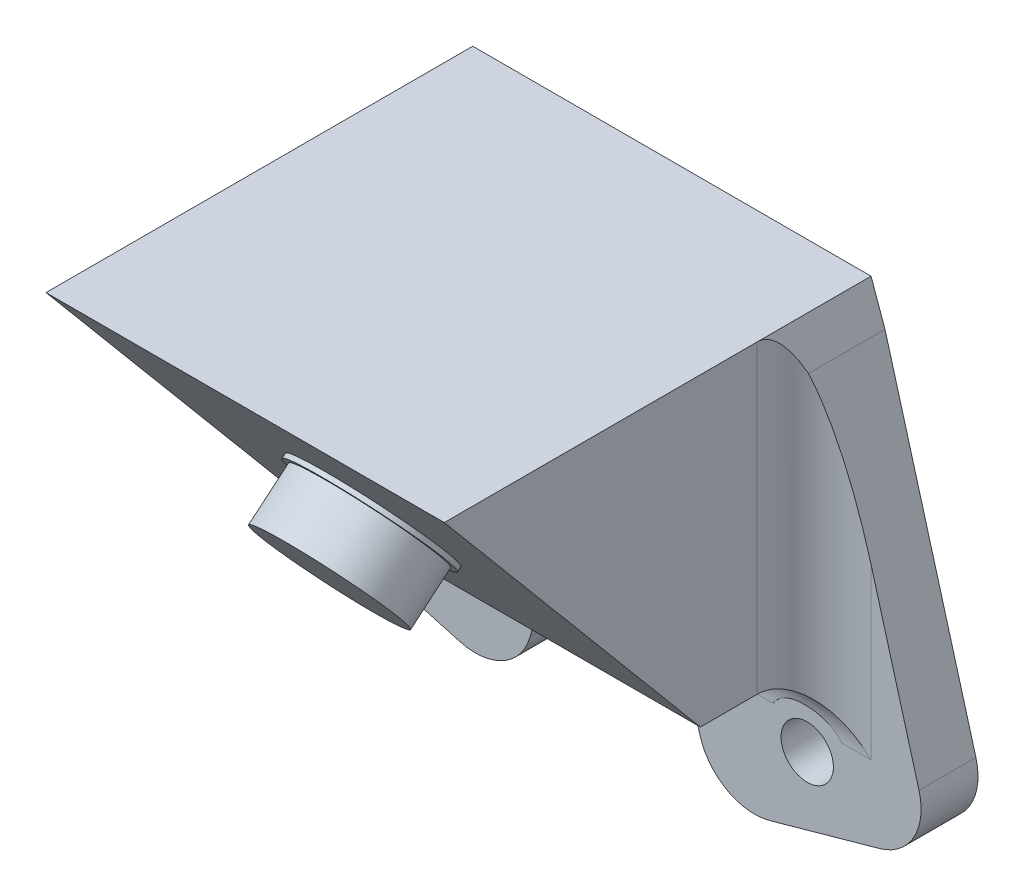
from build123d import *

# Parameters (mm, degrees)
AUFSATZ_LINEAR_AUSTRAGEN1_DEPTH    = 35
SKIZZE3_R                          = 6
AUFSATZ_LINEAR_AUSTRAGEN2_DEPTH    = 5
SKIZZE4_R                          = 6.5
AUFSATZ_LINEAR_AUSTRAGEN3_DEPTH    = 0.4
K_RPER_VERSCHIEBEN_KOPIEREN1_ANGLE = 90
SKIZZE9_R                          = 2.3
AUFSATZ_LINEAR_AUSTRAGEN4_DEPTH    = 5
VERRUNDUNG1_R                      = 5
SKIZZE11_R                         = 3.75
SCHNITT_LINEAR_AUSTRAGEN2_DEPTH    = 10
SKIZZE12_R                         = 1.425
SCHNITT_LINEAR_AUSTRAGEN3_DEPTH    = 9


with BuildPart() as part:
    # Skizze1 → Aufsatz-Linear austragen1 (new body)
    with BuildSketch(Plane(origin=(0, 0, 0), x_dir=(0, 0, -1), z_dir=(1, 0, 0))):
        Polygon((0, 0), (26.811555509, 0), (26.811555509, 37.497566339), (0, 15), align=None)
    extrude(amount=AUFSATZ_LINEAR_AUSTRAGEN1_DEPTH)

    # Skizze3 → Aufsatz-Linear austragen2 (add)
    with BuildSketch(Plane(origin=(0, 8.802361333, 7.386058148), x_dir=(1, 0, 0), z_dir=(0, 0.7660444431189768, 0.642787609686541))):
        with Locations(Location((17.5, 27.141814145, 0), (0, 0, 90))):
            Circle(SKIZZE3_R)
    extrude(amount=AUFSATZ_LINEAR_AUSTRAGEN2_DEPTH)

    # Skizze4 → Aufsatz-Linear austragen3 (add)
    with BuildSketch(Plane(origin=(0, 8.802361333, 7.386058148), x_dir=(1, 0, 0), z_dir=(0, 0.7660444431189767, 0.6427876096865409))):
        with Locations(Location((17.5, 27.141814145, 0), (0, 0, 90))):
            Circle(SKIZZE4_R)
    extrude(amount=AUFSATZ_LINEAR_AUSTRAGEN3_DEPTH)


with BuildPart() as part_1:
    # Körper-Verschieben/Kopieren1: moved
    add(part.part.rotate(Axis((0, 13.64378317, -13.405777755), (1, 0, 0)), K_RPER_VERSCHIEBEN_KOPIEREN1_ANGLE))

    # Skizze9 → Aufsatz-Linear austragen4 (add)
    # profile 1 of 2: a face of its own
    with BuildSketch(Plane(origin=(0, 0, -27.049560924), x_dir=(-1, 0, 0), z_dir=(0, 0, -1))):
        Polygon((-13.006801175, 0.238005415), (-8.700779715, -15.171672686), (10.561317912, -9.789145862), (1.223844944, 23.626259531), (0, 27.049560924), (0, 0.238005415), align=None)
        with Locations(Location((-0.609417277, -6.970434083, 0), (0, 0, 90))):
            Circle(SKIZZE9_R, mode=Mode.SUBTRACT)
    # profile 2 of 2: a face of its own
    with BuildSketch(Plane(origin=(0, 0, -27.049560924), x_dir=(-1, 0, 0), z_dir=(0, 0, -1))):
        Polygon((-45.561317912, -9.789145862), (-36.223844944, 23.626259531), (-35, 27.049560924), (-35, 0.238005415), (-21.993198825, 0.238005415), (-26.299220285, -15.171672686), align=None)
        with Locations(Location((-34.390582723, -6.970434083, 0), (0, 0, 270))):
            Circle(SKIZZE9_R, mode=Mode.SUBTRACT)
    extrude(amount=-AUFSATZ_LINEAR_AUSTRAGEN4_DEPTH)

    # Verrundung1
    # the kernel refuses this fillet: 5 mm, written as the material it adds along each edge
    with BuildSketch(Plane(origin=(35, 27.049560924, -22.049560924), x_dir=(1, 0, 0), z_dir=(0, -1, 0))) as verrundung1_piece_1_section:
        with BuildLine():
            CenterArc((VERRUNDUNG1_R, VERRUNDUNG1_R), VERRUNDUNG1_R, 180, 90)
            Line((0, VERRUNDUNG1_R), (-VERRUNDUNG1_R * 0.02, VERRUNDUNG1_R))
            Line((-VERRUNDUNG1_R * 0.02, VERRUNDUNG1_R), (-VERRUNDUNG1_R * 0.02, -VERRUNDUNG1_R * 0.02))
            Line((-VERRUNDUNG1_R * 0.02, -VERRUNDUNG1_R * 0.02), (VERRUNDUNG1_R, -VERRUNDUNG1_R * 0.02))
            Line((VERRUNDUNG1_R, -VERRUNDUNG1_R * 0.02), (VERRUNDUNG1_R, 0))
        make_face()
    verrundung1_piece_1 = extrude(amount=26.811555509, mode=Mode.PRIVATE)
    verrundung1_piece_1 = split(verrundung1_piece_1, bisect_by=Plane(origin=(39.17481741, 13.065806869, -20.82374956), z_dir=(-0.9631048813334838, -0.2691263412444353, -1.6244750072279728e-13)), keep=Keep.TOP, mode=Mode.PRIVATE)
    verrundung1_piece_1 = split(verrundung1_piece_1, bisect_by=Plane(origin=(39.826476164, 13.549090416, -20.82374956), z_dir=(-0.9416340631335743, -0.3366382199729496, -2.0319838344143382e-13)), keep=Keep.TOP, mode=Mode.PRIVATE)
    add(verrundung1_piece_1)
    with BuildSketch(Plane(origin=(35, 0.238005415, -22.049560924), x_dir=(0, 0, 1), z_dir=(-1, 0, 0))) as verrundung1_piece_2_section:
        with BuildLine():
            CenterArc((VERRUNDUNG1_R, -VERRUNDUNG1_R), VERRUNDUNG1_R, 90, 90)
            Line((0, -VERRUNDUNG1_R), (-VERRUNDUNG1_R * 0.02, -VERRUNDUNG1_R))
            Line((-VERRUNDUNG1_R * 0.02, -VERRUNDUNG1_R), (-VERRUNDUNG1_R * 0.02, VERRUNDUNG1_R * 0.02))
            Line((-VERRUNDUNG1_R * 0.02, VERRUNDUNG1_R * 0.02), (VERRUNDUNG1_R, VERRUNDUNG1_R * 0.02))
            Line((VERRUNDUNG1_R, VERRUNDUNG1_R * 0.02), (VERRUNDUNG1_R, 0))
        make_face()
    verrundung1_piece_2 = extrude(amount=25.506801175, mode=Mode.PRIVATE)
    verrundung1_piece_2 = split(verrundung1_piece_2, bisect_by=Plane(origin=(22.762065147, -2.513486336, -20.902354356), z_dir=(0.9631048813334842, 0.2691263412444339, 1.6244750072279647e-13)), keep=Keep.TOP, mode=Mode.PRIVATE)
    verrundung1_piece_2 = verrundung1_piece_2 - Plane(origin=(34.390582723, -6.970434083, -20.902354356), x_dir=(0, -1, 0), z_dir=(0, 0, -1)) * Cylinder(2.3, 72, mode=Mode.PRIVATE)
    add(verrundung1_piece_2)
    with BuildSketch(Plane(origin=(35, 0.238005415, -22.049560924), x_dir=(0, 0, 1), z_dir=(-1, 0, 0))) as verrundung1_piece_3_section:
        with BuildLine():
            CenterArc((VERRUNDUNG1_R, -VERRUNDUNG1_R), VERRUNDUNG1_R, 90, 90)
            Line((0, -VERRUNDUNG1_R), (-VERRUNDUNG1_R * 0.02, -VERRUNDUNG1_R))
            Line((-VERRUNDUNG1_R * 0.02, -VERRUNDUNG1_R), (-VERRUNDUNG1_R * 0.02, VERRUNDUNG1_R * 0.02))
            Line((-VERRUNDUNG1_R * 0.02, VERRUNDUNG1_R * 0.02), (VERRUNDUNG1_R, VERRUNDUNG1_R * 0.02))
            Line((VERRUNDUNG1_R, VERRUNDUNG1_R * 0.02), (VERRUNDUNG1_R, 0))
        make_face()
    verrundung1_piece_3 = extrude(amount=25.506801175, mode=Mode.PRIVATE)
    verrundung1_piece_3 = split(verrundung1_piece_3, bisect_by=Plane(origin=(12.602046932, -1.210462189, -20.857593889), z_dir=(-0.9631048813334842, 0.26912634124443413, 1.6244750072279654e-13)), keep=Keep.TOP, mode=Mode.PRIVATE)
    add(verrundung1_piece_3)
    with BuildSketch(Plane(origin=(0, 0.238005415, -22.049560924), x_dir=(0, 0, 1), z_dir=(1, 0, 0))) as verrundung1_piece_4_section:
        with BuildLine():
            CenterArc((VERRUNDUNG1_R, VERRUNDUNG1_R), VERRUNDUNG1_R, 180, 90)
            Line((0, VERRUNDUNG1_R), (-VERRUNDUNG1_R * 0.02, VERRUNDUNG1_R))
            Line((-VERRUNDUNG1_R * 0.02, VERRUNDUNG1_R), (-VERRUNDUNG1_R * 0.02, -VERRUNDUNG1_R * 0.02))
            Line((-VERRUNDUNG1_R * 0.02, -VERRUNDUNG1_R * 0.02), (VERRUNDUNG1_R, -VERRUNDUNG1_R * 0.02))
            Line((VERRUNDUNG1_R, -VERRUNDUNG1_R * 0.02), (VERRUNDUNG1_R, 0))
        make_face()
    verrundung1_piece_4 = extrude(amount=25.506801175, mode=Mode.PRIVATE)
    verrundung1_piece_4 = split(verrundung1_piece_4, bisect_by=Plane(origin=(12.237934855, -2.513486327, -20.902354361), z_dir=(-0.9631048813334842, 0.26912634124443413, 1.6244750072279654e-13)), keep=Keep.TOP, mode=Mode.PRIVATE)
    verrundung1_piece_4 = verrundung1_piece_4 - Plane(origin=(0.609417277, -6.970434083, -20.902354361), x_dir=(0, 1, 0), z_dir=(0, 0, -1)) * Cylinder(2.3, 72, mode=Mode.PRIVATE)
    add(verrundung1_piece_4)
    with BuildSketch(Plane(origin=(0, 0.238005415, -22.049560924), x_dir=(0, 0, 1), z_dir=(1, 0, 0))) as verrundung1_piece_5_section:
        with BuildLine():
            CenterArc((VERRUNDUNG1_R, VERRUNDUNG1_R), VERRUNDUNG1_R, 180, 90)
            Line((0, VERRUNDUNG1_R), (-VERRUNDUNG1_R * 0.02, VERRUNDUNG1_R))
            Line((-VERRUNDUNG1_R * 0.02, VERRUNDUNG1_R), (-VERRUNDUNG1_R * 0.02, -VERRUNDUNG1_R * 0.02))
            Line((-VERRUNDUNG1_R * 0.02, -VERRUNDUNG1_R * 0.02), (VERRUNDUNG1_R, -VERRUNDUNG1_R * 0.02))
            Line((VERRUNDUNG1_R, -VERRUNDUNG1_R * 0.02), (VERRUNDUNG1_R, 0))
        make_face()
    verrundung1_piece_5 = extrude(amount=25.506801175, mode=Mode.PRIVATE)
    verrundung1_piece_5 = split(verrundung1_piece_5, bisect_by=Plane(origin=(22.397953068, -1.210462189, -20.857593889), z_dir=(0.9631048813334842, 0.2691263412444339, 1.6244750072279647e-13)), keep=Keep.TOP, mode=Mode.PRIVATE)
    add(verrundung1_piece_5)
    with BuildSketch(Plane(origin=(0, 27.049560924, -22.049560924), x_dir=(0, 0, 1), z_dir=(0, -1, 0))) as verrundung1_piece_6_section:
        with BuildLine():
            CenterArc((VERRUNDUNG1_R, VERRUNDUNG1_R), VERRUNDUNG1_R, 180, 90)
            Line((0, VERRUNDUNG1_R), (-VERRUNDUNG1_R * 0.02, VERRUNDUNG1_R))
            Line((-VERRUNDUNG1_R * 0.02, VERRUNDUNG1_R), (-VERRUNDUNG1_R * 0.02, -VERRUNDUNG1_R * 0.02))
            Line((-VERRUNDUNG1_R * 0.02, -VERRUNDUNG1_R * 0.02), (VERRUNDUNG1_R, -VERRUNDUNG1_R * 0.02))
            Line((VERRUNDUNG1_R, -VERRUNDUNG1_R * 0.02), (VERRUNDUNG1_R, 0))
        make_face()
    verrundung1_piece_6 = extrude(amount=26.811555509, mode=Mode.PRIVATE)
    verrundung1_piece_6 = split(verrundung1_piece_6, bisect_by=Plane(origin=(-4.17481741, 13.06580687, -20.82374956), z_dir=(0.9631048813334837, -0.26912634124443535, -1.6244750072279728e-13)), keep=Keep.TOP, mode=Mode.PRIVATE)
    verrundung1_piece_6 = split(verrundung1_piece_6, bisect_by=Plane(origin=(-4.826476163, 13.549090417, -20.82374956), z_dir=(0.9416340631335748, -0.3366382199729482, -2.0319838344143293e-13)), keep=Keep.TOP, mode=Mode.PRIVATE)
    add(verrundung1_piece_6)
    with BuildSketch(Plane(origin=(21.993198825, 0.238005415, -27.049560924), x_dir=(-1, 0, 0), z_dir=(0, 0, 1))) as verrundung1_piece_7:
        with BuildLine():
            CenterArc((VERRUNDUNG1_R * 0.758872343938, VERRUNDUNG1_R), VERRUNDUNG1_R, 195.612285688, 74.387714312)
            Line((-VERRUNDUNG1_R * 0.204232537396, VERRUNDUNG1_R * 0.730873658756), (-VERRUNDUNG1_R * 0.223494635022, VERRUNDUNG1_R * 0.725491131931))
            Line((-VERRUNDUNG1_R * 0.223494635022, VERRUNDUNG1_R * 0.725491131931), (-VERRUNDUNG1_R * 0.0151774468788, -VERRUNDUNG1_R * 0.02))
            Line((-VERRUNDUNG1_R * 0.0151774468788, -VERRUNDUNG1_R * 0.02), (VERRUNDUNG1_R * 0.758872343938, -VERRUNDUNG1_R * 0.02))
            Line((VERRUNDUNG1_R * 0.758872343938, -VERRUNDUNG1_R * 0.02), (VERRUNDUNG1_R * 0.758872343938, 0))
        make_face()
    extrude(amount=5)
    with BuildSketch(Plane(origin=(13.006801175, 0.238005415, -27.049560924), x_dir=(1, 0, 0), z_dir=(0, 0, 1))) as verrundung1_piece_8:
        with BuildLine():
            CenterArc((VERRUNDUNG1_R * 0.758872343938, -VERRUNDUNG1_R), VERRUNDUNG1_R, 90, 74.387714312)
            Line((-VERRUNDUNG1_R * 0.204232537396, -VERRUNDUNG1_R * 0.730873658756), (-VERRUNDUNG1_R * 0.223494635022, -VERRUNDUNG1_R * 0.725491131931))
            Line((-VERRUNDUNG1_R * 0.223494635022, -VERRUNDUNG1_R * 0.725491131931), (-VERRUNDUNG1_R * 0.0151774468788, VERRUNDUNG1_R * 0.02))
            Line((-VERRUNDUNG1_R * 0.0151774468788, VERRUNDUNG1_R * 0.02), (VERRUNDUNG1_R * 0.758872343938, VERRUNDUNG1_R * 0.02))
            Line((VERRUNDUNG1_R * 0.758872343938, VERRUNDUNG1_R * 0.02), (VERRUNDUNG1_R * 0.758872343938, 0))
        make_face()
    extrude(amount=5)
    with BuildSketch(Plane(origin=(47.5, 0.238005415, -22.049560924), x_dir=(0, 0, 1), z_dir=(-1, 0, 0))) as verrundung1_piece_9a_section:
        with BuildLine():
            CenterArc((VERRUNDUNG1_R, -VERRUNDUNG1_R), VERRUNDUNG1_R, 90, 90)
            Line((0, -VERRUNDUNG1_R), (-VERRUNDUNG1_R * 0.02, -VERRUNDUNG1_R))
            Line((-VERRUNDUNG1_R * 0.02, -VERRUNDUNG1_R), (-VERRUNDUNG1_R * 0.02, VERRUNDUNG1_R * 0.02))
            Line((-VERRUNDUNG1_R * 0.02, VERRUNDUNG1_R * 0.02), (VERRUNDUNG1_R, VERRUNDUNG1_R * 0.02))
            Line((VERRUNDUNG1_R, VERRUNDUNG1_R * 0.02), (VERRUNDUNG1_R, 0))
        make_face()
    verrundung1_piece_9a = extrude(amount=38.006801175, mode=Mode.PRIVATE)
    verrundung1_piece_9a = split(verrundung1_piece_9a, bisect_by=Plane(origin=(35, -0.934173805, -20.941336544), z_dir=(1, 0, 0)), keep=Keep.TOP, mode=Mode.PRIVATE)
    verrundung1_piece_9a = split(verrundung1_piece_9a, bisect_by=Plane(origin=(42.794054861, 0.1138779, -20.941336544), z_dir=(-0.9631048813334838, -0.2691263412444353, -1.6244750072279728e-13)), keep=Keep.TOP, mode=Mode.PRIVATE)
    with BuildSketch(Plane(origin=(35, 27.049560924, -22.049560924), x_dir=(1, 0, 0), z_dir=(0, -1, 0))) as verrundung1_piece_9b_section:
        with BuildLine():
            CenterArc((VERRUNDUNG1_R, VERRUNDUNG1_R), VERRUNDUNG1_R, 180, 90)
            Line((0, VERRUNDUNG1_R), (-VERRUNDUNG1_R * 0.02, VERRUNDUNG1_R))
            Line((-VERRUNDUNG1_R * 0.02, VERRUNDUNG1_R), (-VERRUNDUNG1_R * 0.02, -VERRUNDUNG1_R * 0.02))
            Line((-VERRUNDUNG1_R * 0.02, -VERRUNDUNG1_R * 0.02), (VERRUNDUNG1_R, -VERRUNDUNG1_R * 0.02))
            Line((VERRUNDUNG1_R, -VERRUNDUNG1_R * 0.02), (VERRUNDUNG1_R, 0))
        make_face()
    verrundung1_piece_9b = extrude(amount=39.311555509, mode=Mode.PRIVATE)
    verrundung1_piece_9b = split(verrundung1_piece_9b, bisect_by=Plane(origin=(38.695669586, 0.238005415, -21.917388299), z_dir=(0, -1, 0)), keep=Keep.TOP, mode=Mode.PRIVATE)
    verrundung1_piece_9b = split(verrundung1_piece_9b, bisect_by=Plane(origin=(39.091980364, -11.596912781, -21.917388299), z_dir=(-0.2691263412444344, 0.963104881333484, 5.813402738026697e-13)), keep=Keep.TOP, mode=Mode.PRIVATE)
    verrundung1_piece_9b = verrundung1_piece_9b - Plane(origin=(34.390582723, -6.970434083, -21.917388299), x_dir=(0, -1, 0), z_dir=(0, 0, -1)) * Cylinder(2.3, 99, mode=Mode.PRIVATE)
    verrundung1_piece_9 = verrundung1_piece_9a & verrundung1_piece_9b
    add(verrundung1_piece_9)
    with BuildSketch(Plane(origin=(21.993198825, 0.238005415, -27.049560924), x_dir=(-1, 0, 0), z_dir=(0, 0, 1))) as verrundung1_piece_10a_section:
        with BuildLine():
            CenterArc((VERRUNDUNG1_R * 0.758872343938, VERRUNDUNG1_R), VERRUNDUNG1_R, 195.612285688, 74.387714312)
            Line((-VERRUNDUNG1_R * 0.204232537396, VERRUNDUNG1_R * 0.730873658756), (-VERRUNDUNG1_R * 0.223494635022, VERRUNDUNG1_R * 0.725491131931))
            Line((-VERRUNDUNG1_R * 0.223494635022, VERRUNDUNG1_R * 0.725491131931), (-VERRUNDUNG1_R * 0.0151774468788, -VERRUNDUNG1_R * 0.02))
            Line((-VERRUNDUNG1_R * 0.0151774468788, -VERRUNDUNG1_R * 0.02), (VERRUNDUNG1_R * 0.758872343938, -VERRUNDUNG1_R * 0.02))
            Line((VERRUNDUNG1_R * 0.758872343938, -VERRUNDUNG1_R * 0.02), (VERRUNDUNG1_R * 0.758872343938, 0))
        make_face()
    verrundung1_piece_10a = extrude(amount=14.485904299, mode=Mode.PRIVATE)
    verrundung1_piece_10a = split(verrundung1_piece_10a, bisect_by=Plane(origin=(21.381573581, -0.567960502, -22.049560924), z_dir=(0, 0, 1)), keep=Keep.TOP, mode=Mode.PRIVATE)
    with BuildSketch(Plane(origin=(35, 0.238005415, -22.049560924), x_dir=(0, 0, 1), z_dir=(-1, 0, 0))) as verrundung1_piece_10b_section:
        with BuildLine():
            CenterArc((VERRUNDUNG1_R, -VERRUNDUNG1_R), VERRUNDUNG1_R, 90, 90)
            Line((0, -VERRUNDUNG1_R), (-VERRUNDUNG1_R * 0.02, -VERRUNDUNG1_R))
            Line((-VERRUNDUNG1_R * 0.02, -VERRUNDUNG1_R), (-VERRUNDUNG1_R * 0.02, VERRUNDUNG1_R * 0.02))
            Line((-VERRUNDUNG1_R * 0.02, VERRUNDUNG1_R * 0.02), (VERRUNDUNG1_R, VERRUNDUNG1_R * 0.02))
            Line((VERRUNDUNG1_R, VERRUNDUNG1_R * 0.02), (VERRUNDUNG1_R, 0))
        make_face()
    verrundung1_piece_10b = extrude(amount=25.506801175, mode=Mode.PRIVATE)
    verrundung1_piece_10b = split(verrundung1_piece_10b, bisect_by=Plane(origin=(13.021336565, 0.290022269, -20.957466714), z_dir=(0.9631048813334842, -0.26912634124443413, -1.6244750072279654e-13)), keep=Keep.TOP, mode=Mode.PRIVATE)
    verrundung1_piece_10b = split(verrundung1_piece_10b, bisect_by=Plane(origin=(21.978663435, 0.290022269, -20.957466714), z_dir=(-0.9631048813334842, -0.2691263412444339, -1.6244750072279647e-13)), keep=Keep.TOP, mode=Mode.PRIVATE)
    verrundung1_piece_10 = verrundung1_piece_10a & verrundung1_piece_10b
    add(verrundung1_piece_10)
    with BuildSketch(Plane(origin=(-12.5, 0.238005415, -22.049560924), x_dir=(0, 0, 1), z_dir=(1, 0, 0))) as verrundung1_piece_11a_section:
        with BuildLine():
            CenterArc((VERRUNDUNG1_R, VERRUNDUNG1_R), VERRUNDUNG1_R, 180, 90)
            Line((0, VERRUNDUNG1_R), (-VERRUNDUNG1_R * 0.02, VERRUNDUNG1_R))
            Line((-VERRUNDUNG1_R * 0.02, VERRUNDUNG1_R), (-VERRUNDUNG1_R * 0.02, -VERRUNDUNG1_R * 0.02))
            Line((-VERRUNDUNG1_R * 0.02, -VERRUNDUNG1_R * 0.02), (VERRUNDUNG1_R, -VERRUNDUNG1_R * 0.02))
            Line((VERRUNDUNG1_R, -VERRUNDUNG1_R * 0.02), (VERRUNDUNG1_R, 0))
        make_face()
    verrundung1_piece_11a = extrude(amount=38.006801175, mode=Mode.PRIVATE)
    verrundung1_piece_11a = split(verrundung1_piece_11a, bisect_by=Plane(origin=(0, -0.934173805, -20.941336544), z_dir=(-1, 0, 0)), keep=Keep.TOP, mode=Mode.PRIVATE)
    verrundung1_piece_11a = split(verrundung1_piece_11a, bisect_by=Plane(origin=(-7.794054861, 0.1138779, -20.941336544), z_dir=(0.9631048813334837, -0.26912634124443535, -1.6244750072279728e-13)), keep=Keep.TOP, mode=Mode.PRIVATE)
    with BuildSketch(Plane(origin=(0, 27.049560924, -22.049560924), x_dir=(0, 0, 1), z_dir=(0, -1, 0))) as verrundung1_piece_11b_section:
        with BuildLine():
            CenterArc((VERRUNDUNG1_R, VERRUNDUNG1_R), VERRUNDUNG1_R, 180, 90)
            Line((0, VERRUNDUNG1_R), (-VERRUNDUNG1_R * 0.02, VERRUNDUNG1_R))
            Line((-VERRUNDUNG1_R * 0.02, VERRUNDUNG1_R), (-VERRUNDUNG1_R * 0.02, -VERRUNDUNG1_R * 0.02))
            Line((-VERRUNDUNG1_R * 0.02, -VERRUNDUNG1_R * 0.02), (VERRUNDUNG1_R, -VERRUNDUNG1_R * 0.02))
            Line((VERRUNDUNG1_R, -VERRUNDUNG1_R * 0.02), (VERRUNDUNG1_R, 0))
        make_face()
    verrundung1_piece_11b = extrude(amount=39.311555509, mode=Mode.PRIVATE)
    verrundung1_piece_11b = split(verrundung1_piece_11b, bisect_by=Plane(origin=(-0.132172609, 0.238005415, -18.353891343), z_dir=(0, -1, 0)), keep=Keep.TOP, mode=Mode.PRIVATE)
    verrundung1_piece_11b = split(verrundung1_piece_11b, bisect_by=Plane(origin=(-0.786583865, -12.520560126, -18.353891343), z_dir=(0.2691263412444344, 0.963104881333484, 5.813402738026697e-13)), keep=Keep.TOP, mode=Mode.PRIVATE)
    verrundung1_piece_11b = verrundung1_piece_11b - Plane(origin=(0.609417277, -6.970434083, -18.353891343), x_dir=(0, 1, 0), z_dir=(0, 0, -1)) * Cylinder(2.3, 99, mode=Mode.PRIVATE)
    verrundung1_piece_11 = verrundung1_piece_11a & verrundung1_piece_11b
    add(verrundung1_piece_11)
    with BuildSketch(Plane(origin=(0, 0.238005415, -22.049560924), x_dir=(0, 0, 1), z_dir=(1, 0, 0))) as verrundung1_piece_12a_section:
        with BuildLine():
            CenterArc((VERRUNDUNG1_R, VERRUNDUNG1_R), VERRUNDUNG1_R, 180, 90)
            Line((0, VERRUNDUNG1_R), (-VERRUNDUNG1_R * 0.02, VERRUNDUNG1_R))
            Line((-VERRUNDUNG1_R * 0.02, VERRUNDUNG1_R), (-VERRUNDUNG1_R * 0.02, -VERRUNDUNG1_R * 0.02))
            Line((-VERRUNDUNG1_R * 0.02, -VERRUNDUNG1_R * 0.02), (VERRUNDUNG1_R, -VERRUNDUNG1_R * 0.02))
            Line((VERRUNDUNG1_R, -VERRUNDUNG1_R * 0.02), (VERRUNDUNG1_R, 0))
        make_face()
    verrundung1_piece_12a = extrude(amount=25.506801175, mode=Mode.PRIVATE)
    verrundung1_piece_12a = split(verrundung1_piece_12a, bisect_by=Plane(origin=(13.021336565, 0.290022269, -20.957466714), z_dir=(0.9631048813334842, -0.26912634124443413, -1.6244750072279654e-13)), keep=Keep.TOP, mode=Mode.PRIVATE)
    verrundung1_piece_12a = split(verrundung1_piece_12a, bisect_by=Plane(origin=(21.978663435, 0.290022269, -20.957466714), z_dir=(-0.9631048813334842, -0.2691263412444339, -1.6244750072279647e-13)), keep=Keep.TOP, mode=Mode.PRIVATE)
    with BuildSketch(Plane(origin=(13.006801175, 0.238005415, -27.049560924), x_dir=(1, 0, 0), z_dir=(0, 0, 1))) as verrundung1_piece_12b_section:
        with BuildLine():
            CenterArc((VERRUNDUNG1_R * 0.758872343938, -VERRUNDUNG1_R), VERRUNDUNG1_R, 90, 74.387714312)
            Line((-VERRUNDUNG1_R * 0.204232537396, -VERRUNDUNG1_R * 0.730873658756), (-VERRUNDUNG1_R * 0.223494635022, -VERRUNDUNG1_R * 0.725491131931))
            Line((-VERRUNDUNG1_R * 0.223494635022, -VERRUNDUNG1_R * 0.725491131931), (-VERRUNDUNG1_R * 0.0151774468788, VERRUNDUNG1_R * 0.02))
            Line((-VERRUNDUNG1_R * 0.0151774468788, VERRUNDUNG1_R * 0.02), (VERRUNDUNG1_R * 0.758872343938, VERRUNDUNG1_R * 0.02))
            Line((VERRUNDUNG1_R * 0.758872343938, VERRUNDUNG1_R * 0.02), (VERRUNDUNG1_R * 0.758872343938, 0))
        make_face()
    verrundung1_piece_12b = extrude(amount=14.485904299, mode=Mode.PRIVATE)
    verrundung1_piece_12b = split(verrundung1_piece_12b, bisect_by=Plane(origin=(13.618426419, -0.567960502, -22.049560924), z_dir=(0, 0, 1)), keep=Keep.TOP, mode=Mode.PRIVATE)
    verrundung1_piece_12 = verrundung1_piece_12a & verrundung1_piece_12b
    add(verrundung1_piece_12)
    # the kernel refuses this fillet: 5 mm, written as the material it takes off along each edge
    with BuildSketch(Plane(origin=(45.561317912, -9.789145861, -39.549560924), x_dir=(-0.2691263412444356, 0.9631048813334836, 5.813402738026695e-13), z_dir=(0, 0, 1)), Plane(origin=(26.299220285, -15.171672686, -39.549560924), x_dir=(0.9631048813334839, 0.2691263412444345, 1.6244750072279685e-13), z_dir=(0, 0, 1)), Plane(origin=(8.700779715, -15.171672686, -39.549560924), x_dir=(0.2691263412444342, 0.9631048813334839, 5.813402738026696e-13), z_dir=(0, 0, 1)), Plane(origin=(-10.561317912, -9.789145861, -39.549560924), x_dir=(0.9631048813334839, -0.2691263412444342, -1.6244750072279662e-13), z_dir=(0, 0, 1))) as verrundung1_2_piece_1:
        with BuildLine():
            CenterArc((VERRUNDUNG1_R, VERRUNDUNG1_R), VERRUNDUNG1_R, 180, 90)
            Line((0, VERRUNDUNG1_R), (-VERRUNDUNG1_R * 0.02, VERRUNDUNG1_R))
            Line((-VERRUNDUNG1_R * 0.02, VERRUNDUNG1_R), (-VERRUNDUNG1_R * 0.02, -VERRUNDUNG1_R * 0.02))
            Line((-VERRUNDUNG1_R * 0.02, -VERRUNDUNG1_R * 0.02), (VERRUNDUNG1_R, -VERRUNDUNG1_R * 0.02))
            Line((VERRUNDUNG1_R, -VERRUNDUNG1_R * 0.02), (VERRUNDUNG1_R, 0))
        make_face()
    extrude(amount=30, mode=Mode.SUBTRACT)

    # Skizze11 → Schnitt-Linear austragen2 (cut)
    with BuildSketch(Plane.XY.offset(-22.049560924)):
        with Locations((0.609417277, -6.970434083)):
            Circle(SKIZZE11_R)
        with Locations((34.390582723, -6.970434083)):
            Circle(SKIZZE11_R)
    extrude(amount=SCHNITT_LINEAR_AUSTRAGEN2_DEPTH, mode=Mode.SUBTRACT)

    # Skizze12 → Schnitt-Linear austragen3 (cut)
    with BuildSketch(Plane(origin=(0, 0, -27.049560924), x_dir=(-1, 0, 0), z_dir=(0, 0, -1))):
        with Locations(Location((-17.5, 21.873797801, 0), (0, 0, 90))):
            Circle(SKIZZE12_R)
    extrude(amount=-SCHNITT_LINEAR_AUSTRAGEN3_DEPTH, mode=Mode.SUBTRACT)


solid = part_1.part
